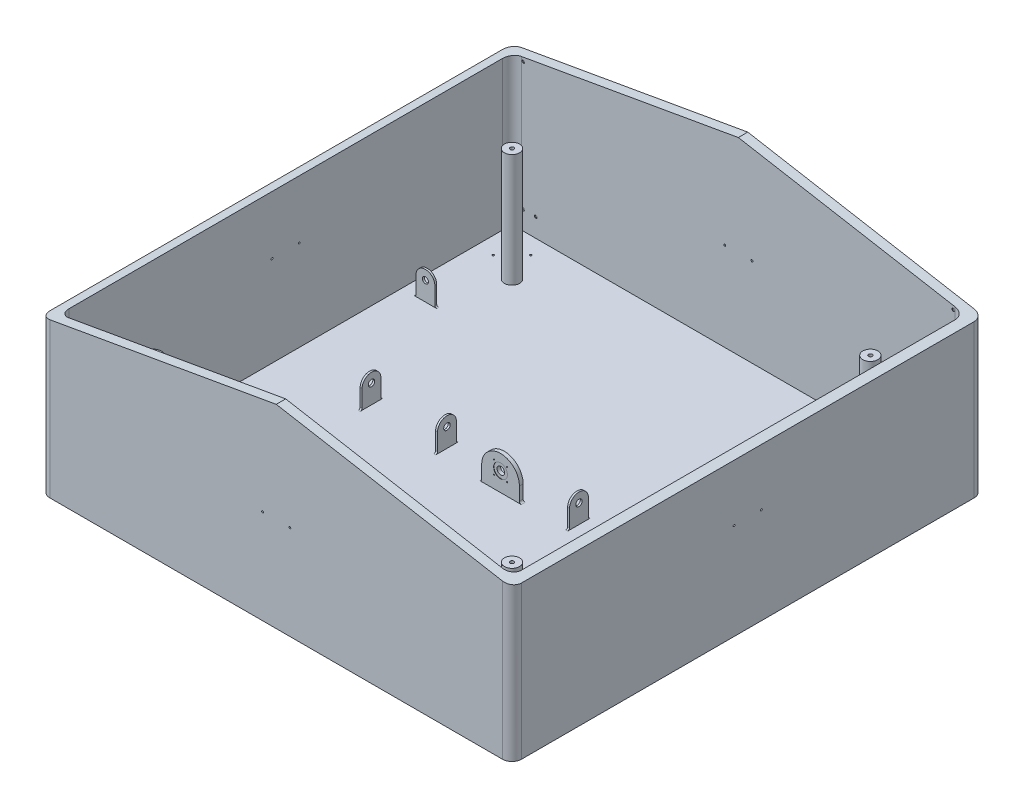
from build123d import *

# Parameters (mm, degrees)
EXTRUDE_1_DEPTH               = 30
EXTRUDE_2_DEPTH               = 1000
CUT_EXTRUDE_1_REACH           = 2980.825
SKETCH_4_R                    = 7.5
CUT_EXTRUDE_2_DEPTH           = 5
SKETCH_5_R                    = 7.5
CUT_EXTRUDE_3_DEPTH           = 5
MIRROR_2_COPY_1_SKETCH_R      = 7.5
MIRROR_2_COPY_1_DEPTH         = 5
MIRROR_2_COPY_2_SKETCH_R      = 7.5
MIRROR_2_COPY_2_DEPTH         = 5
SKETCH_6_R                    = 7.5
CUT_EXTRUDE_4_DEPTH           = 5
MIRROR_4_COPY_1_SKETCH_R      = 7.5
MIRROR_4_COPY_1_DEPTH         = 5
SKETCH_9_W                    = 100
SKETCH_9_H                    = 150
SKETCH_9_R                    = 17
SKETCH_9_R_2                  = 7.5
EXTRUDE_3_DEPTH               = 5
FILLET_1_RADIUS               = 50
FILLET_1_LENGTH               = 10
FILLET_2_R                    = 10
MIRROR_START                  = 615
MIRROR_6_OUTLINE_R            = 17
MIRROR_6_DEPTH                = 10
MIRROR_START_2                = -625
MIRROR_7_OUTLINE_R            = 17
MIRROR_7_DEPTH                = 10
MIRROR_7_2_OUTLINE_R          = 17
MIRROR_7_2_DEPTH              = 10
SKETCH_12_W                   = 10
SKETCH_12_H                   = 100
EXTRUDE_4_DEPTH               = 150
FILLET_3_RADIUS               = 50
FILLET_3_LENGTH               = 10
FILLET_4_RADIUS               = 50
FILLET_4_LENGTH               = 10
FILLET_5_R                    = 10
SKETCH_13_R                   = 17
CUT_EXTRUDE_6_DEPTH           = 700
FILLET_3_OF_MIRROR_8_2_RADIUS = 50
FILLET_3_OF_MIRROR_8_2_LENGTH = 10
FILLET_4_OF_MIRROR_8_2_RADIUS = 50
FILLET_4_OF_MIRROR_8_2_LENGTH = 10
FILLET_5_OF_MIRROR_8_R        = 10
SKETCH_11_W                   = 200
SKETCH_11_H                   = 20
EXTRUDE_5_DEPTH               = 180
SKETCH_14_R                   = 20
CUT_EXTRUDE_7_DEPTH           = 120
SKETCH_16_R                   = 2.75
CUT_EXTRUDE_8_DEPTH           = 10
SKETCH_17_R                   = 36.51
CUT_EXTRUDE_9_DEPTH           = 1.52
FILLET_6_R                    = 10
FILLET_7_RADIUS               = 100
FILLET_7_LENGTH               = 20
SKETCH_21_R                   = 17
SKETCH_21_R_2                 = 16
EXTRUDE_9_DEPTH               = 10
SKETCH_22_R                   = 17
SKETCH_22_R_2                 = 16
EXTRUDE_10_DEPTH              = 10
SKETCH_23_R                   = 5
CUT_EXTRUDE_10_DEPTH          = 2032.009601159
MIRROR_10_COPY_1_SKETCH_R     = 5
MIRROR_10_COPY_1_DEPTH        = 2032.009601159
SKETCH_24_R                   = 5
CUT_EXTRUDE_11_DEPTH          = 2500
SKETCH_25_R                   = 5
CUT_EXTRUDE_12_DEPTH          = 2500
EXTRUDE_11_DEPTH              = 600


# Read off the part's stored shape, not the designer's step: Зеркальное отражение6, Зеркальное отражение7
with BuildPart() as part:
    # Эскиз1 → Бобышка-Вытянуть1 (new body)
    with BuildSketch(Plane(origin=(0, 0, 0), x_dir=(1, 0, 0), z_dir=(0, 1, 0))):
        with BuildLine():
            Line((-1200, -1250), (1200, -1250))
            ThreePointArc((1200, -1250), (1235.355339059, -1235.355339059), (1250, -1200))
            Line((1250, -1200), (1250, 1200))
            ThreePointArc((1250, 1200), (1235.355339059, 1235.355339059), (1200, 1250))
            Line((1200, 1250), (-1200, 1250))
            ThreePointArc((-1200, 1250), (-1235.355339059, 1235.355339059), (-1250, 1200))
            Line((-1250, 1200), (-1250, -1200))
            ThreePointArc((-1250, -1200), (-1235.355339059, -1235.355339059), (-1200, -1250))
        make_face()
    extrude(amount=EXTRUDE_1_DEPTH)

    # Эскиз2 → Бобышка-Вытянуть2 (add)
    with BuildSketch(Plane(origin=(0, 30, 0), x_dir=(1, 0, 0), z_dir=(0, 1, 0))):
        with BuildLine():
            Line((-1200, -1250), (1200, -1250))
            ThreePointArc((1200, -1250), (1235.355339059, -1235.355339059), (1250, -1200))
            Line((1250, -1200), (1250, 1200))
            ThreePointArc((1250, 1200), (1235.355339059, 1235.355339059), (1200, 1250))
            Line((1200, 1250), (-1200, 1250))
            ThreePointArc((-1200, 1250), (-1235.355339059, 1235.355339059), (-1250, 1200))
            Line((-1250, 1200), (-1250, -1200))
            ThreePointArc((-1250, -1200), (-1235.355339059, -1235.355339059), (-1200, -1250))
        make_face()
        with BuildLine():
            Line((-1150, -1200), (1150, -1200))
            ThreePointArc((1150, -1200), (1185.355339059, -1185.355339059), (1200, -1150))
            Line((1200, -1150), (1200, 1150))
            ThreePointArc((1200, 1150), (1185.355339059, 1185.355339059), (1150, 1200))
            Line((1150, 1200), (-1150, 1200))
            ThreePointArc((-1150, 1200), (-1185.355339059, 1185.355339059), (-1200, 1150))
            Line((-1200, 1150), (-1200, -1150))
            ThreePointArc((-1200, -1150), (-1185.355339059, -1185.355339059), (-1150, -1200))
        make_face(mode=Mode.SUBTRACT)
    extrude(amount=EXTRUDE_2_DEPTH)

    # Эскиз3 → Вырез-Вытянуть1 (cut, up to next)
    with BuildSketch(Plane.XY.offset(1250), mode=Mode.PRIVATE) as cut_extrude_1_sk1:
        Polygon((0, 1030), (1300, 800.774925079), (1300, 1030), (-1300, 1030), (-1300, 800.774925079), align=None)
    cut_extrude_1_tool1 = extrude(cut_extrude_1_sk1.sketch, amount=-CUT_EXTRUDE_1_REACH, mode=Mode.PRIVATE) & part.part
    add(cut_extrude_1_tool1.solids().sort_by_distance((654.532365, 941.091783, 1250))[0], mode=Mode.SUBTRACT)
    add(cut_extrude_1_tool1.solids().sort_by_distance((654.532365, 941.091783, 1250))[1], mode=Mode.SUBTRACT)

    # Эскиз4 → Вырез-Вытянуть2 (cut)
    with BuildSketch(Plane(origin=(0, 0, 1200), x_dir=(-1, 0, 0), z_dir=(0, 0, -1))):
        with Locations((-1140, 808.678709755)):
            Circle(SKETCH_4_R)
    cut_extrude_2 = extrude(amount=-CUT_EXTRUDE_2_DEPTH, mode=Mode.SUBTRACT)

    # Эскиз5 → Вырез-Вытянуть3 (cut)
    with BuildSketch(Plane(origin=(0, 0, 1200), x_dir=(-1, 0, 0), z_dir=(0, 0, -1))):
        with Locations((-1140, 130)):
            Circle(SKETCH_5_R)
    cut_extrude_3 = extrude(amount=-CUT_EXTRUDE_3_DEPTH, mode=Mode.SUBTRACT)

    # Зеркальное отражение1: Вырез-Вытянуть2, Вырез-Вытянуть3 across plane
    add(cut_extrude_2.mirror(Plane.XY), mode=Mode.SUBTRACT)
    add(cut_extrude_3.mirror(Plane.XY), mode=Mode.SUBTRACT)

    # Зеркальное отражение2: Вырез-Вытянуть2, Вырез-Вытянуть3 across plane
    add(cut_extrude_2.mirror(Plane(origin=(0, 0, 0), x_dir=(0, 0, 1), z_dir=(1, 0, 0))), mode=Mode.SUBTRACT)
    add(cut_extrude_3.mirror(Plane(origin=(0, 0, 0), x_dir=(0, 0, 1), z_dir=(1, 0, 0))), mode=Mode.SUBTRACT)

    # Зеркальное отражение2 copy 1 sketch → Зеркальное отражение2 copy 1 (cut)
    with BuildSketch(Plane.XY.offset(-1200)):
        with Locations((-1140, 808.678709755)):
            Circle(MIRROR_2_COPY_1_SKETCH_R)
    extrude(amount=-MIRROR_2_COPY_1_DEPTH, mode=Mode.SUBTRACT)

    # Зеркальное отражение2 copy 2 sketch → Зеркальное отражение2 copy 2 (cut)
    with BuildSketch(Plane.XY.offset(-1200)):
        with Locations((-1140, 130)):
            Circle(MIRROR_2_COPY_2_SKETCH_R)
    extrude(amount=-MIRROR_2_COPY_2_DEPTH, mode=Mode.SUBTRACT)

    # Эскиз6 → Вырез-Вытянуть4 (cut)
    with BuildSketch(Plane(origin=(0, 0, 1200), x_dir=(-1, 0, 0), z_dir=(0, 0, -1))):
        with Locations((-1074, 130)):
            Circle(SKETCH_6_R)
    cut_extrude_4 = extrude(amount=-CUT_EXTRUDE_4_DEPTH, mode=Mode.SUBTRACT)

    # Зеркальное отражение3: Вырез-Вытянуть4 across plane
    add(cut_extrude_4.mirror(Plane.XY), mode=Mode.SUBTRACT)

    # Зеркальное отражение4: Вырез-Вытянуть4 across plane
    add(cut_extrude_4.mirror(Plane(origin=(0, 0, 0), x_dir=(0, 0, 1), z_dir=(1, 0, 0))), mode=Mode.SUBTRACT)

    # Зеркальное отражение4 copy 1 sketch → Зеркальное отражение4 copy 1 (cut)
    with BuildSketch(Plane.XY.offset(-1200)):
        with Locations((-1074, 130)):
            Circle(MIRROR_4_COPY_1_SKETCH_R)
    extrude(amount=-MIRROR_4_COPY_1_DEPTH, mode=Mode.SUBTRACT)

    # Эскиз9 → Бобышка-Вытянуть3 (add, symmetric)
    # profile 1 of 2: a face of its own
    with BuildSketch(Plane.XY.offset(-620)):
        with Locations((-1074, 105)):
            Rectangle(SKETCH_9_W, SKETCH_9_H)
        with Locations((-1074, 130)):
            Circle(SKETCH_9_R, mode=Mode.SUBTRACT)
    # profile 2 of 2: a face of its own
    with BuildSketch(Plane.XY.offset(-620)):
        with Locations((-1074, 130)):
            Circle(SKETCH_9_R_2)
    extrude(amount=EXTRUDE_3_DEPTH, both=True)


with BuildPart() as extrude_3_kept_piece:
    # of the separate pieces the step leaves, the one the design keeps (extrude_3_pieces_kept)
    add(part.part.solids().sort_by_distance((-1200, 818.40762315, 1250))[0])

    # Скругление1: full round fillet: the end face becomes a half cylinder, R = half its width
    fillet_1_face = Plane((-1074, 180, -620), x_dir=(0, 0, 1), z_dir=(0, 1, 0))  # on the end face: x along it, z out of the body
    fillet_1_slab = fillet_1_face.offset(-FILLET_1_RADIUS / 2) * Box(FILLET_1_LENGTH, 2 * FILLET_1_RADIUS, FILLET_1_RADIUS, mode=Mode.PRIVATE)  # the body's end, R deep
    fillet_1_round = Plane((-1074, 130, -620), x_dir=(0, 1, 0), z_dir=(0, 0, 1)) * Cylinder(FILLET_1_RADIUS, FILLET_1_LENGTH, mode=Mode.PRIVATE)  # its axis R under the face
    add(fillet_1_slab - fillet_1_round, mode=Mode.SUBTRACT)

    # Скругление2
    fillet_2_edges = [extrude_3_kept_piece.edges().sort_by_distance(p)[0] for p in [
        (-1124, 30, -620),
        (-1024, 30, -620),
    ]]
    fillet(fillet_2_edges, radius=FILLET_2_R)

    # Зеркальное отражение6 outline → Зеркальное отражение6 (add)
    with BuildSketch(Plane.XY.offset(MIRROR_START)):
        with BuildLine():
            Line((-1024, 40), (-1024, 130))
            ThreePointArc((-1024, 130), (-1074, 180), (-1124, 130))
            Line((-1124, 130), (-1124, 40))
            ThreePointArc((-1124, 40), (-1126.928932188, 32.928932188), (-1134, 30))
            Line((-1134, 30), (-1014, 30))
            ThreePointArc((-1014, 30), (-1021.071067812, 32.928932188), (-1024, 40))
        make_face()
        with Locations((-1074, 130)):
            Circle(MIRROR_6_OUTLINE_R, mode=Mode.SUBTRACT)
    extrude(amount=MIRROR_6_DEPTH)

    # Зеркальное отражение7 outline → Зеркальное отражение7 (add)
    with BuildSketch(Plane.XY.offset(MIRROR_START_2)):
        with BuildLine():
            ThreePointArc((1124, 130), (1074, 180), (1024, 130))
            Line((1024, 130), (1024, 40))
            ThreePointArc((1024, 40), (1021.071067812, 32.928932188), (1014, 30))
            Line((1014, 30), (1134, 30))
            ThreePointArc((1134, 30), (1126.928932188, 32.928932188), (1124, 40))
            Line((1124, 40), (1124, 130))
        make_face()
        with Locations((1074, 130)):
            Circle(MIRROR_7_OUTLINE_R, mode=Mode.SUBTRACT)
    extrude(amount=MIRROR_7_DEPTH)

    # Mirror 7 2 outline → Mirror 7 2 (add)
    with BuildSketch(Plane.XY.offset(MIRROR_START)):
        with BuildLine():
            ThreePointArc((1124, 130), (1074, 180), (1024, 130))
            Line((1024, 130), (1024, 40))
            ThreePointArc((1024, 40), (1021.071067812, 32.928932188), (1014, 30))
            Line((1014, 30), (1134, 30))
            ThreePointArc((1134, 30), (1126.928932188, 32.928932188), (1124, 40))
            Line((1124, 40), (1124, 130))
        make_face()
        with Locations((1074, 130)):
            Circle(MIRROR_7_2_OUTLINE_R, mode=Mode.SUBTRACT)
    extrude(amount=MIRROR_7_2_DEPTH)

    # Эскиз12 → Бобышка-Вытянуть4 (add)
    with BuildSketch(Plane(origin=(0, 30, 0), x_dir=(1, 0, 0), z_dir=(0, 1, 0))):
        with Locations((-750, 0)):
            Rectangle(SKETCH_12_W, SKETCH_12_H)
        with Locations((-350, 0)):
            Rectangle(SKETCH_12_W, SKETCH_12_H)
    extrude_4 = extrude(amount=EXTRUDE_4_DEPTH)

    # Скругление3: full round fillet: the end face becomes a half cylinder, R = half its width
    fillet_3_face = Plane((-750, 180, 0), x_dir=(-1, 0, 0), z_dir=(0, 1, 0))  # on the end face: x along it, z out of the body
    fillet_3_slab = fillet_3_face.offset(-FILLET_3_RADIUS / 2) * Box(FILLET_3_LENGTH, 2 * FILLET_3_RADIUS, FILLET_3_RADIUS, mode=Mode.PRIVATE)  # the body's end, R deep
    fillet_3_round = Plane((-750, 130, 0), x_dir=(0, 1, 0), z_dir=(-1, 0, 0)) * Cylinder(FILLET_3_RADIUS, FILLET_3_LENGTH, mode=Mode.PRIVATE)  # its axis R under the face
    add(fillet_3_slab - fillet_3_round, mode=Mode.SUBTRACT)

    # Скругление4: full round fillet: the end face becomes a half cylinder, R = half its width
    fillet_4_face = Plane((-350, 180, 0), x_dir=(-1, 0, 0), z_dir=(0, 1, 0))  # on the end face: x along it, z out of the body
    fillet_4_slab = fillet_4_face.offset(-FILLET_4_RADIUS / 2) * Box(FILLET_4_LENGTH, 2 * FILLET_4_RADIUS, FILLET_4_RADIUS, mode=Mode.PRIVATE)  # the body's end, R deep
    fillet_4_round = Plane((-350, 130, 0), x_dir=(0, 1, 0), z_dir=(-1, 0, 0)) * Cylinder(FILLET_4_RADIUS, FILLET_4_LENGTH, mode=Mode.PRIVATE)  # its axis R under the face
    add(fillet_4_slab - fillet_4_round, mode=Mode.SUBTRACT)

    # Скругление5
    fillet_5_edges = [extrude_3_kept_piece.edges().sort_by_distance(p)[0] for p in [
        (-750, 30, 50),
        (-750, 30, -50),
        (-350, 30, 50),
        (-350, 30, -50),
    ]]
    fillet(fillet_5_edges, radius=FILLET_5_R)

    # Эскиз13 → Вырез-Вытянуть6 (cut)
    with BuildSketch(Plane(origin=(-345, 0, 0), x_dir=(0, 0, -1), z_dir=(1, 0, 0))):
        with Locations((0, 130)):
            Circle(SKETCH_13_R)
    cut_extrude_6 = extrude(amount=-CUT_EXTRUDE_6_DEPTH, mode=Mode.SUBTRACT)

    # Зеркальное отражение8: Бобышка-Вытянуть4, Вырез-Вытянуть6 across plane
    add(extrude_4.mirror(Plane(origin=(0, 0, 0), x_dir=(0, 0, 1), z_dir=(1, 0, 0))))
    add(cut_extrude_6.mirror(Plane(origin=(0, 0, 0), x_dir=(0, 0, 1), z_dir=(1, 0, 0))), mode=Mode.SUBTRACT)

    # Скругление3 of Mirror 8 2: full round fillet: the end face becomes a half cylinder, R = half its width
    fillet_3_of_mirror_8_2_face = Plane((750, 180, 0), x_dir=(1, 0, 0), z_dir=(0, 1, 0))  # on the end face: x along it, z out of the body
    fillet_3_of_mirror_8_2_slab = fillet_3_of_mirror_8_2_face.offset(-FILLET_3_OF_MIRROR_8_2_RADIUS / 2) * Box(FILLET_3_OF_MIRROR_8_2_LENGTH, 2 * FILLET_3_OF_MIRROR_8_2_RADIUS, FILLET_3_OF_MIRROR_8_2_RADIUS, mode=Mode.PRIVATE)  # the body's end, R deep
    fillet_3_of_mirror_8_2_round = Plane((750, 130, 0), x_dir=(0, 1, 0), z_dir=(1, 0, 0)) * Cylinder(FILLET_3_OF_MIRROR_8_2_RADIUS, FILLET_3_OF_MIRROR_8_2_LENGTH, mode=Mode.PRIVATE)  # its axis R under the face
    add(fillet_3_of_mirror_8_2_slab - fillet_3_of_mirror_8_2_round, mode=Mode.SUBTRACT)

    # Скругление4 of Mirror 8 2: full round fillet: the end face becomes a half cylinder, R = half its width
    fillet_4_of_mirror_8_2_face = Plane((350, 180, 0), x_dir=(1, 0, 0), z_dir=(0, 1, 0))  # on the end face: x along it, z out of the body
    fillet_4_of_mirror_8_2_slab = fillet_4_of_mirror_8_2_face.offset(-FILLET_4_OF_MIRROR_8_2_RADIUS / 2) * Box(FILLET_4_OF_MIRROR_8_2_LENGTH, 2 * FILLET_4_OF_MIRROR_8_2_RADIUS, FILLET_4_OF_MIRROR_8_2_RADIUS, mode=Mode.PRIVATE)  # the body's end, R deep
    fillet_4_of_mirror_8_2_round = Plane((350, 130, 0), x_dir=(0, 1, 0), z_dir=(1, 0, 0)) * Cylinder(FILLET_4_OF_MIRROR_8_2_RADIUS, FILLET_4_OF_MIRROR_8_2_LENGTH, mode=Mode.PRIVATE)  # its axis R under the face
    add(fillet_4_of_mirror_8_2_slab - fillet_4_of_mirror_8_2_round, mode=Mode.SUBTRACT)

    # Скругление5 of Зеркальное отражение8
    fillet_5_of_mirror_8_edges = [extrude_3_kept_piece.edges().sort_by_distance(p)[0] for p in [
        (750, 30, 50),
        (750, 30, -50),
        (350, 30, 50),
        (350, 30, -50),
    ]]
    fillet(fillet_5_of_mirror_8_edges, radius=FILLET_5_OF_MIRROR_8_R)

    # Эскиз11 → Бобышка-Вытянуть5 (add)
    with BuildSketch(Plane(origin=(0, 30, 0), x_dir=(1, 0, 0), z_dir=(0, 1, 0))):
        with Locations((0, -50.8)):
            Rectangle(SKETCH_11_W, SKETCH_11_H)
    extrude(amount=EXTRUDE_5_DEPTH)

    # Эскиз14 → Вырез-Вытянуть7 (cut)
    with BuildSketch(Plane.XY.offset(60.8)):
        with Locations((0, 130)):
            Circle(SKETCH_14_R)
    extrude(amount=-CUT_EXTRUDE_7_DEPTH, mode=Mode.SUBTRACT)

    # Эскиз16 → Вырез-Вытянуть8 (cut)
    with BuildSketch(Plane.XY.offset(60.8)):
        with Locations((-34.75, 164.75)):
            Circle(SKETCH_16_R)
        with Locations((-34.75, 95.25)):
            Circle(SKETCH_16_R)
        with Locations((34.75, 95.25)):
            Circle(SKETCH_16_R)
        with Locations((34.75, 164.75)):
            Circle(SKETCH_16_R)
    extrude(amount=-CUT_EXTRUDE_8_DEPTH, mode=Mode.SUBTRACT)

    # Эскиз17 → Вырез-Вытянуть9 (cut)
    with BuildSketch(Plane.XY.offset(60.8)):
        with Locations((0, 130)):
            Circle(SKETCH_17_R)
    extrude(amount=-CUT_EXTRUDE_9_DEPTH, mode=Mode.SUBTRACT)

    # Скругление6
    fillet_6_edges = [extrude_3_kept_piece.edges().sort_by_distance(p)[0] for p in [
        (-100, 30, 50.8),
        (100, 30, 50.8),
    ]]
    fillet(fillet_6_edges, radius=FILLET_6_R)

    # Скругление7: full round fillet: the end face becomes a half cylinder, R = half its width
    fillet_7_face = Plane((0, 210, 50.8), x_dir=(0, 0, -1), z_dir=(0, 1, 0))  # on the end face: x along it, z out of the body
    fillet_7_slab = fillet_7_face.offset(-FILLET_7_RADIUS / 2) * Box(FILLET_7_LENGTH, 2 * FILLET_7_RADIUS, FILLET_7_RADIUS, mode=Mode.PRIVATE)  # the body's end, R deep
    fillet_7_round = Plane((0, 110, 50.8), x_dir=(0, 1, 0), z_dir=(0, 0, -1)) * Cylinder(FILLET_7_RADIUS, FILLET_7_LENGTH, mode=Mode.PRIVATE)  # its axis R under the face
    add(fillet_7_slab - fillet_7_round, mode=Mode.SUBTRACT)

    # Эскиз21 → Бобышка-Вытянуть9 (add)
    with BuildSketch(Plane.XY.offset(625)):
        with Locations(Location((1074, 130, 0), (0, 0, 180))):
            Circle(SKETCH_21_R)
        with Locations((1074, 130)):
            Circle(SKETCH_21_R_2, mode=Mode.SUBTRACT)
    extrude(amount=-EXTRUDE_9_DEPTH)

    # Эскиз22 → Бобышка-Вытянуть10 (add)
    with BuildSketch(Plane.XY.offset(-615)):
        with Locations((-1074, 130)):
            Circle(SKETCH_22_R)
        with Locations((-1074, 130)):
            Circle(SKETCH_22_R_2, mode=Mode.SUBTRACT)
    extrude(amount=-EXTRUDE_10_DEPTH)

    # Эскиз23 → Вырез-Вытянуть10 (cut, through all)
    with BuildSketch(Plane(origin=(0, 30, 0), x_dir=(1, 0, 0), z_dir=(0, 1, 0))):
        with Locations(Location((1110, -1110, 0), (0, 0, 270))):
            Circle(SKETCH_23_R)
        with Locations(Location((1010, -1110, 0), (0, 0, 270))):
            Circle(SKETCH_23_R)
        with Locations(Location((1010, -1010, 0), (0, 0, 270))):
            Circle(SKETCH_23_R)
        with Locations(Location((1110, -1010, 0), (0, 0, 270))):
            Circle(SKETCH_23_R)
    cut_extrude_10 = extrude(amount=-CUT_EXTRUDE_10_DEPTH, mode=Mode.SUBTRACT)

    # Зеркальное отражение9: Вырез-Вытянуть10 across plane
    add(cut_extrude_10.mirror(Plane.XY), mode=Mode.SUBTRACT)

    # Зеркальное отражение10: Вырез-Вытянуть10 across plane
    add(cut_extrude_10.mirror(Plane(origin=(0, 0, 0), x_dir=(0, 0, 1), z_dir=(1, 0, 0))), mode=Mode.SUBTRACT)

    # Зеркальное отражение10 copy 1 sketch → Зеркальное отражение10 copy 1 (cut, through all)
    with BuildSketch(Plane(origin=(0, 30, 0), x_dir=(-1, 0, 0), z_dir=(0, 1, 0))):
        with Locations(Location((1110, -1110, 0), (0, 0, 270))):
            Circle(MIRROR_10_COPY_1_SKETCH_R)
        with Locations(Location((1010, -1110, 0), (0, 0, 270))):
            Circle(MIRROR_10_COPY_1_SKETCH_R)
        with Locations(Location((1010, -1010, 0), (0, 0, 270))):
            Circle(MIRROR_10_COPY_1_SKETCH_R)
        with Locations(Location((1110, -1010, 0), (0, 0, 270))):
            Circle(MIRROR_10_COPY_1_SKETCH_R)
    extrude(amount=-MIRROR_10_COPY_1_DEPTH, mode=Mode.SUBTRACT)

    # Эскиз24 → Вырез-Вытянуть11 (cut)
    with BuildSketch(Plane.ZY.offset(1250)):
        with Locations((-72.225, 509.591274114)):
            Circle(SKETCH_24_R)
        with Locations((72.225, 509.591274114)):
            Circle(SKETCH_24_R)
    extrude(amount=-CUT_EXTRUDE_11_DEPTH, mode=Mode.SUBTRACT)

    # Эскиз25 → Вырез-Вытянуть12 (cut)
    with BuildSketch(Plane.XY.offset(1250)):
        with Locations((-72.225, 500)):
            Circle(SKETCH_25_R)
        with Locations((72.225, 500)):
            Circle(SKETCH_25_R)
    extrude(amount=-CUT_EXTRUDE_12_DEPTH, mode=Mode.SUBTRACT)

    # Эскиз26 → Бобышка-Вытянуть11 (add)
    with BuildSketch(Plane(origin=(0, 30, 0), x_dir=(1, 0, 0), z_dir=(0, 1, 0))):
        with BuildLine():
            ThreePointArc((-910, 950), (-978.284271247, 978.284271247), (-950, 910))
            Line((-950, 910), (-950, 940))
            ThreePointArc((-950, 940), (-957.071067812, 957.071067812), (-940, 950))
            Line((-940, 950), (-910, 950))
        make_face()
        with BuildLine():
            Line((-950, 940), (-950, 910))
            ThreePointArc((-950, 910), (-921.715728753, 921.715728753), (-910, 950))
            Line((-910, 950), (-940, 950))
            ThreePointArc((-940, 950), (-942.928932188, 942.928932188), (-950, 940))
        make_face()
        with BuildLine():
            ThreePointArc((910, 950), (921.715728753, 921.715728753), (950, 910))
            Line((950, 910), (950, 940))
            ThreePointArc((950, 940), (942.928932188, 942.928932188), (940, 950))
            Line((940, 950), (910, 950))
        make_face()
        with BuildLine():
            Line((950, 940), (950, 910))
            ThreePointArc((950, 910), (978.284271247, 921.715728753), (990, 950))
            ThreePointArc((990, 950), (950, 990), (910, 950))
            Line((910, 950), (940, 950))
            ThreePointArc((940, 950), (950, 960), (960, 950))
            ThreePointArc((960, 950), (957.071067812, 942.928932188), (950, 940))
        make_face()
        with BuildLine():
            ThreePointArc((950, -910), (921.715728753, -921.715728753), (910, -950))
            Line((910, -950), (940, -950))
            ThreePointArc((940, -950), (942.928932188, -942.928932188), (950, -940))
            Line((950, -940), (950, -910))
        make_face()
        with BuildLine():
            Line((940, -950), (910, -950))
            ThreePointArc((910, -950), (950, -990), (990, -950))
            ThreePointArc((990, -950), (978.284271247, -921.715728753), (950, -910))
            Line((950, -910), (950, -940))
            ThreePointArc((950, -940), (957.071067812, -942.928932188), (960, -950))
            ThreePointArc((960, -950), (950, -960), (940, -950))
        make_face()
        with BuildLine():
            ThreePointArc((-950, -940), (-942.928932188, -942.928932188), (-940, -950))
            Line((-940, -950), (-910, -950))
            ThreePointArc((-910, -950), (-921.715728753, -921.715728753), (-950, -910))
            Line((-950, -910), (-950, -940))
        make_face()
        with BuildLine():
            Line((-910, -950), (-940, -950))
            ThreePointArc((-940, -950), (-957.071067812, -957.071067812), (-950, -940))
            Line((-950, -940), (-950, -910))
            ThreePointArc((-950, -910), (-978.284271247, -978.284271247), (-910, -950))
        make_face()
    extrude(amount=EXTRUDE_11_DEPTH)


solid = extrude_3_kept_piece.part
